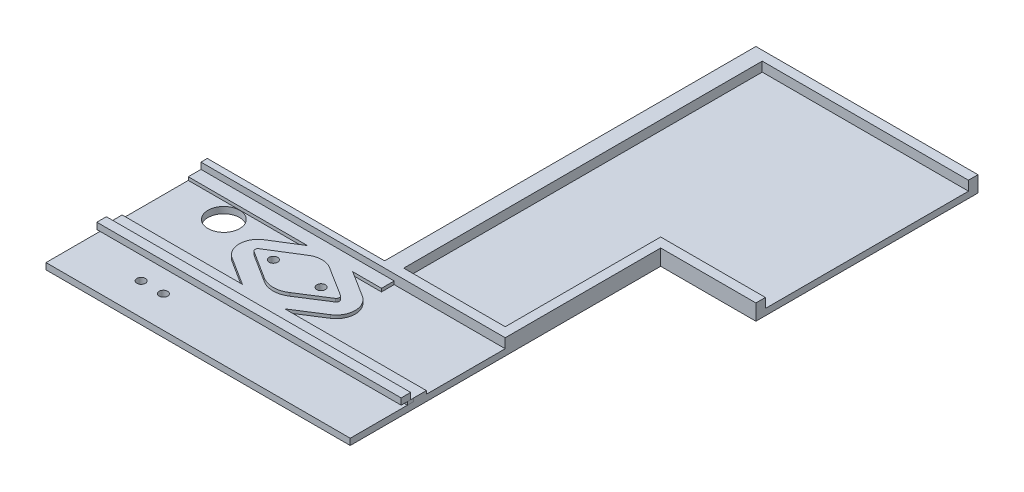
from build123d import *

# Parameters (mm, degrees)
EXTRUDE_1_DEPTH          = 1
EXTRUDE_2_DEPTH          = 1
SKETCH_5_W               = 95.882599
SKETCH_5_H               = 27.8428
EXTRUDE_3_DEPTH          = 2
CUT_EXTRUDE_1_DEPTH      = 100.923442209
CUT_EXTRUDE_1_DEPTH_BACK = 100.923442209
SKETCH_6_R               = 5
CUT_EXTRUDE_2_DEPTH      = 100.923442209
CUT_EXTRUDE_2_DEPTH_BACK = 100.923442209
SKETCH_7_R               = 1.35
SKETCH_8_W               = 95.882599
SKETCH_8_H               = 20
EXTRUDE_4_DEPTH          = 2
EXTRUDE_5_DEPTH          = 1
SKETCH_10_W              = 40
SKETCH_10_H              = 120
EXTRUDE_6_DEPTH          = 2
EXTRUDE_START            = -3
EXTRUDE_7_DEPTH          = 3
SKETCH_12_W              = 5
SKETCH_12_H              = 123
EXTRUDE_8_DEPTH          = 1
EXTRUDE_9_OUTLINE_W      = 95.901549254
EXTRUDE_9_OUTLINE_H      = 3
EXTRUDE_9_OUTLINE_W_2    = 95.885
EXTRUDE_9_OUTLINE_H_2    = 2
EXTRUDE_9_DEPTH          = 2
EXTRUDE_START_2          = -1
EXTRUDE_9_2_OUTLINE_W    = 95.885
EXTRUDE_9_2_OUTLINE_H    = 2
EXTRUDE_9_2_DEPTH        = 1
CUT_EXTRUDE_3_DEPTH      = 177.247383378
CUT_EXTRUDE_3_DEPTH_BACK = 177.247383378
SKETCH_16_R              = 1.35
SKETCH_17_W              = 30
SKETCH_17_H              = 70
EXTRUDE_10_DEPTH         = 2
EXTRUDE_11_DEPTH         = 3


# Read off the part's stored shape, not the designer's step: 凸台-拉伸9
with BuildPart() as part:
    # 草图3 → 凸台-拉伸1 (new body)
    with BuildSketch(Plane(origin=(0, 0, 0), x_dir=(1, 0, 0), z_dir=(0, 1, 0))):
        with BuildLine():
            Line((41.882488294, 21.631498957), (31.610829647, 15.243028334))
            ThreePointArc((31.610829647, 15.243028334), (31.350600602, 14.569512784), (31.613242469, 13.896934459))
            Line((31.613242469, 13.896934459), (40.546880152, 8.234769731))
            ThreePointArc((40.546880152, 8.234769731), (44.573930655, 7.017936995), (48.601204689, 8.234029718))
            Line((48.601204689, 8.234029718), (57.364385058, 13.822144736))
            ThreePointArc((57.364385058, 13.822144736), (57.798599734, 14.63340346), (57.366705056, 15.44589967))
            Line((57.366705056, 15.44589967), (47.51874726, 21.632437259))
            ThreePointArc((47.51874726, 21.632437259), (44.700511427, 22.270800367), (41.882488294, 21.631498957))
        make_face()
    extrude(amount=EXTRUDE_1_DEPTH)

    # 草图4 → 凸台-拉伸2 (add)
    with BuildSketch(Plane.XZ):
        with BuildLine():
            Line((49.96883361, -25.998027869), (60.064619869, -19.655803167))
            ThreePointArc((60.064619869, -19.655803167), (62.798594558, -14.643390815), (60.079038247, -9.623140954))
            Line((60.079038247, -9.623140954), (51.324268762, -4.040389399))
            ThreePointArc((51.324268762, -4.040389399), (44.577632655, -2.01793734), (37.829997654, -4.03705422))
            Line((37.829997654, -4.03705422), (28.614522584, -9.877848279))
            ThreePointArc((28.614522584, -9.877848279), (26.350608769, -14.582124379), (28.631489707, -19.27819737))
            Line((28.631489707, -19.27819737), (39.443234024, -26.002574933))
            ThreePointArc((39.443234024, -26.002574933), (44.706582673, -27.270799381), (49.96883361, -25.998027869))
        make_face()
    extrude(amount=EXTRUDE_2_DEPTH)

    # 草图5 → 凸台-拉伸3 (add)
    with BuildSketch(Plane.XZ.offset(1)):
        with Locations((47.9412995, -13.9214)):
            Rectangle(SKETCH_5_W, SKETCH_5_H)
    extrude(amount=EXTRUDE_3_DEPTH)

    # 草图6 → 切除-拉伸1 (cut, two sides: drawn at the far end of the back side and taken through both)
    with BuildSketch(Plane.XZ.offset(3).offset(-CUT_EXTRUDE_1_DEPTH_BACK)):
        with Locations(Location((16.25, -19.8, 0), (0, 0, 270))):
            Circle(SKETCH_6_R)
    extrude(amount=CUT_EXTRUDE_1_DEPTH + CUT_EXTRUDE_1_DEPTH_BACK, mode=Mode.SUBTRACT)

    # 草图7 → 切除-拉伸2 (cut, two sides: drawn at the far end of the back side and taken through both)
    with BuildSketch(Plane(origin=(0, 1, 0), x_dir=(1, 0, 0), z_dir=(0, 1, 0)).offset(-CUT_EXTRUDE_2_DEPTH_BACK)):
        with Locations(Location((37.074600168, 14.583340303, 0), (0, 0, 270))):
            Circle(SKETCH_7_R)
        with Locations(Location((52.074600168, 14.619575942, 0), (0, 0, 270))):
            Circle(SKETCH_7_R)
    extrude(amount=CUT_EXTRUDE_2_DEPTH + CUT_EXTRUDE_2_DEPTH_BACK, mode=Mode.SUBTRACT)

    # 草图8 → 凸台-拉伸4 (add)
    with BuildSketch(Plane(origin=(0, -1, 0), x_dir=(1, 0, 0), z_dir=(0, 1, 0))):
        with Locations((47.9412995, -10)):
            Rectangle(SKETCH_8_W, SKETCH_8_H)
    extrude(amount=-EXTRUDE_4_DEPTH)

    # 草图9 → 凸台-拉伸5 (add)
    with BuildSketch(Plane(origin=(0, -1, 0), x_dir=(1, 0, 0), z_dir=(0, 1, 0))):
        Polygon((0, 0), (0, 4), (95.882599, 4), (95.882599, 0), (95.898271126, -2), (-0.002401, -2), align=None)
    extrude(amount=EXTRUDE_5_DEPTH)

    # 草图10 → 凸台-拉伸6 (add)
    with BuildSketch(Plane(origin=(0, -1, 0), x_dir=(1, 0, 0), z_dir=(0, 1, 0))):
        with Locations((75.882599, 87.8428)):
            Rectangle(SKETCH_10_W, SKETCH_10_H)
    extrude(amount=-EXTRUDE_6_DEPTH)

    # 草图11 → 凸台-拉伸7 (add)
    with BuildSketch(Plane.XZ.offset(3).offset(EXTRUDE_START)):
        Polygon((-0.002401, -27.8428), (-0.002401, -30.8428), (55.882599, -30.8428), (55.882599, -27.8428), (55.882599, -24.8428), (0, -24.8428), align=None)
    extrude(amount=EXTRUDE_7_DEPTH)

    # 草图12 → 凸台-拉伸8 (add)
    with BuildSketch(Plane(origin=(0, -1, 0), x_dir=(1, 0, 0), z_dir=(0, 1, 0))):
        with Locations((58.382599, 86.3428)):
            Rectangle(SKETCH_12_W, SKETCH_12_H)
    extrude(amount=EXTRUDE_8_DEPTH)

    # 凸台-拉伸9 outline → 凸台-拉伸9 (add)
    with BuildSketch(Plane(origin=(0, 0, 0), x_dir=(1, 0, 0), z_dir=(0, 1, 0))):
        with Locations((47.948373627, -2.4702)):
            Rectangle(EXTRUDE_9_OUTLINE_W, EXTRUDE_9_OUTLINE_H)
        with Locations((47.940099, 29.8428)):
            Rectangle(EXTRUDE_9_OUTLINE_W_2, EXTRUDE_9_OUTLINE_H_2)
    extrude(amount=EXTRUDE_9_DEPTH)

    # Extrude 9 2 outline → Extrude 9 2 (add)
    with BuildSketch(Plane(origin=(0, 0, 0), x_dir=(1, 0, 0), z_dir=(0, 1, 0)).offset(EXTRUDE_START_2)):
        with Locations((47.940099, 29.8428)):
            Rectangle(EXTRUDE_9_2_OUTLINE_W, EXTRUDE_9_2_OUTLINE_H)
    extrude(amount=EXTRUDE_9_2_DEPTH)

    # 草图16 → 切除-拉伸3 (cut, two sides: drawn at the far end of the back side and taken through both)
    with BuildSketch(Plane(origin=(0, -1, 0), x_dir=(1, 0, 0), z_dir=(0, 1, 0)).offset(-CUT_EXTRUDE_3_DEPTH_BACK)):
        with Locations(Location((19.997599, -10, 0), (0, 0, 270))):
            Circle(SKETCH_16_R)
        with Locations(Location((26.997599, -10, 0), (0, 0, 270))):
            Circle(SKETCH_16_R)
    extrude(amount=CUT_EXTRUDE_3_DEPTH + CUT_EXTRUDE_3_DEPTH_BACK, mode=Mode.SUBTRACT)

    # 草图17 → 凸台-拉伸10 (add)
    with BuildSketch(Plane(origin=(0, -1, 0), x_dir=(1, 0, 0), z_dir=(0, 1, 0))):
        with Locations((110.882599, 112.8428)):
            Rectangle(SKETCH_17_W, SKETCH_17_H)
    extrude(amount=-EXTRUDE_10_DEPTH)

    # 草图18 → 凸台-拉伸11 (add)
    with BuildSketch(Plane(origin=(0, -1, 0), x_dir=(1, 0, 0), z_dir=(0, 1, 0))):
        Polygon((95.882599, 30.8428), (95.882599, 77.8428), (125.882599, 77.8428), (125.882599, 80.8428), (92.882599, 80.8428), (92.882599, 31.8428), (60.882599, 31.8428), (60.882599, 144.8428), (125.882599, 144.8428), (125.882599, 147.8428), (55.882599, 147.8428), (55.882599, 30.8428), (60.882599, 30.8428), align=None)
    extrude(amount=EXTRUDE_11_DEPTH)


solid = part.part
